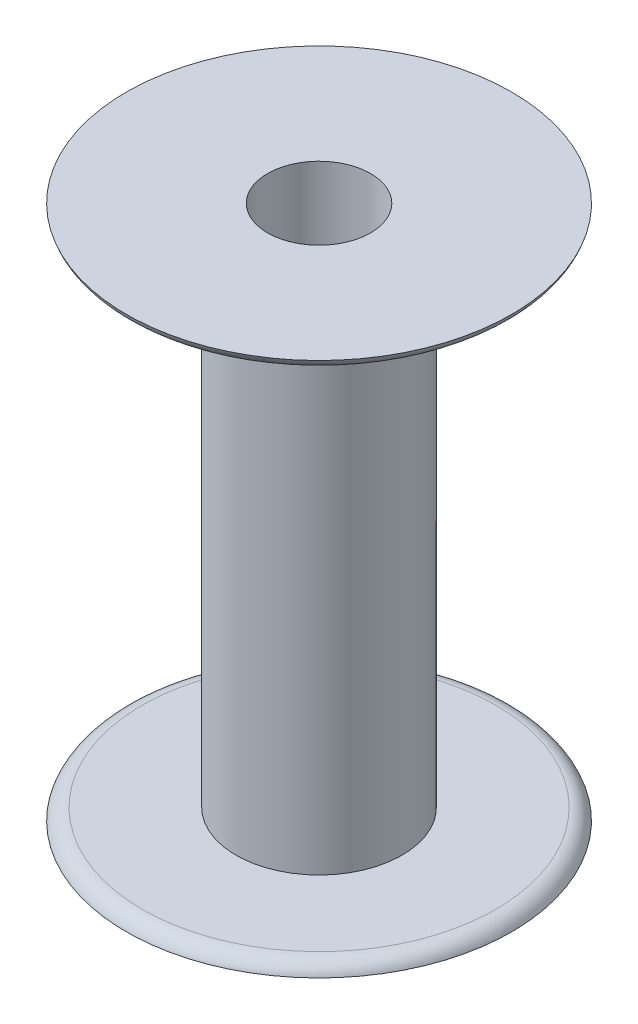
from build123d import *

# Parameters (mm, degrees)
SKETCH2_R          = 3.1
CUT_EXTRUDE1_DEPTH = 37.13806857
FILLET1_R          = 1


with BuildPart() as part:
    # Sketch1 → Revolve1 (revolve)
    with BuildSketch(Plane.XY, mode=Mode.PRIVATE) as revolve1_sk:
        Polygon((0, 0), (0, 16.1), (11.6, 16.1), (11.6, 15.4), (5, 15.4), (5, 0), align=None)
    revolve(revolve1_sk.sketch.rotate(Axis((0, 24.358616114, 0), (0, 1, 0)), 90), axis=Axis((0, 24.358616114, 0), (0, 1, 0)))

    # Mirror1: part across plane


with BuildPart() as part_1:
    add(part.part)
    add(part.part.mirror(Plane(origin=(5, 0, 0), x_dir=(0, 0, 1), z_dir=(0, -1, 0))))

    # Sketch2 → Cut-Extrude1 (cut, through all)
    with BuildSketch(Plane(origin=(0, 16.1, 0), x_dir=(1, 0, 0), z_dir=(0, 1, 0))):
        with Locations(Location((0, 0, 0), (0, 0, 270))):
            Circle(SKETCH2_R)
    extrude(amount=-CUT_EXTRUDE1_DEPTH, mode=Mode.SUBTRACT)

    # Fillet1
    # the kernel refuses this fillet: 1 mm, written as the material it takes off along each edge
    with BuildSketch(Plane(origin=(0, -15.4, 0), x_dir=(0, 0, -1), z_dir=(1, 0, 0))) as fillet1_piece_1:
        with BuildLine():
            CenterArc((10.646060799, -1), FILLET1_R, 17.457603124, 72.542396876)
            Line((10.646060799, 0), (10.646060799, 0.02))
            Line((10.646060799, 0.02), (11.6, 0.02))
            Line((11.6, 0.02), (11.62, 0))
            ThreePointArc((11.62, 0), (11.62, -0.35), (11.619078784, -0.694))
            Line((11.619078784, -0.694), (11.6, -0.7))
        make_face()
    revolve(axis=Axis((0, -15.4, 0), (0, 1, 0)), mode=Mode.SUBTRACT)
    with BuildSketch(Plane(origin=(0, 15.4, 0), x_dir=(0, 0, -1), z_dir=(1, 0, 0))) as fillet1_piece_2:
        with BuildLine():
            CenterArc((10.646060799, 1), FILLET1_R, 270, 72.542396876)
            Line((10.646060799, 0), (10.646060799, -0.02))
            Line((10.646060799, -0.02), (11.6, -0.02))
            Line((11.6, -0.02), (11.62, 0))
            ThreePointArc((11.62, 0), (11.62, 0.35), (11.619078784, 0.694))
            Line((11.619078784, 0.694), (11.6, 0.7))
        make_face()
    revolve(axis=Axis((0, 15.4, 0), (0, 1, 0)), mode=Mode.SUBTRACT)


solid = part_1.part
